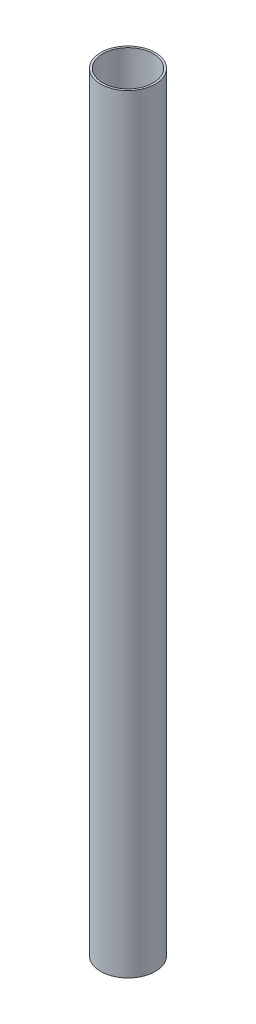
from build123d import *

# Parameters (mm, degrees)
ESBO_O1_R                = 27
ESBO_O1_R_2              = 25
RESSALTO_EXTRUS_O1_DEPTH = 760


with BuildPart() as part:
    # Esboço1 → Ressalto-extrusão1 (new body)
    with BuildSketch(Plane(origin=(0, 0, 0), x_dir=(1, 0, 0), z_dir=(0, 1, 0))):
        Circle(ESBO_O1_R)
        Circle(ESBO_O1_R_2, mode=Mode.SUBTRACT)
    extrude(amount=RESSALTO_EXTRUS_O1_DEPTH)


solid = part.part
